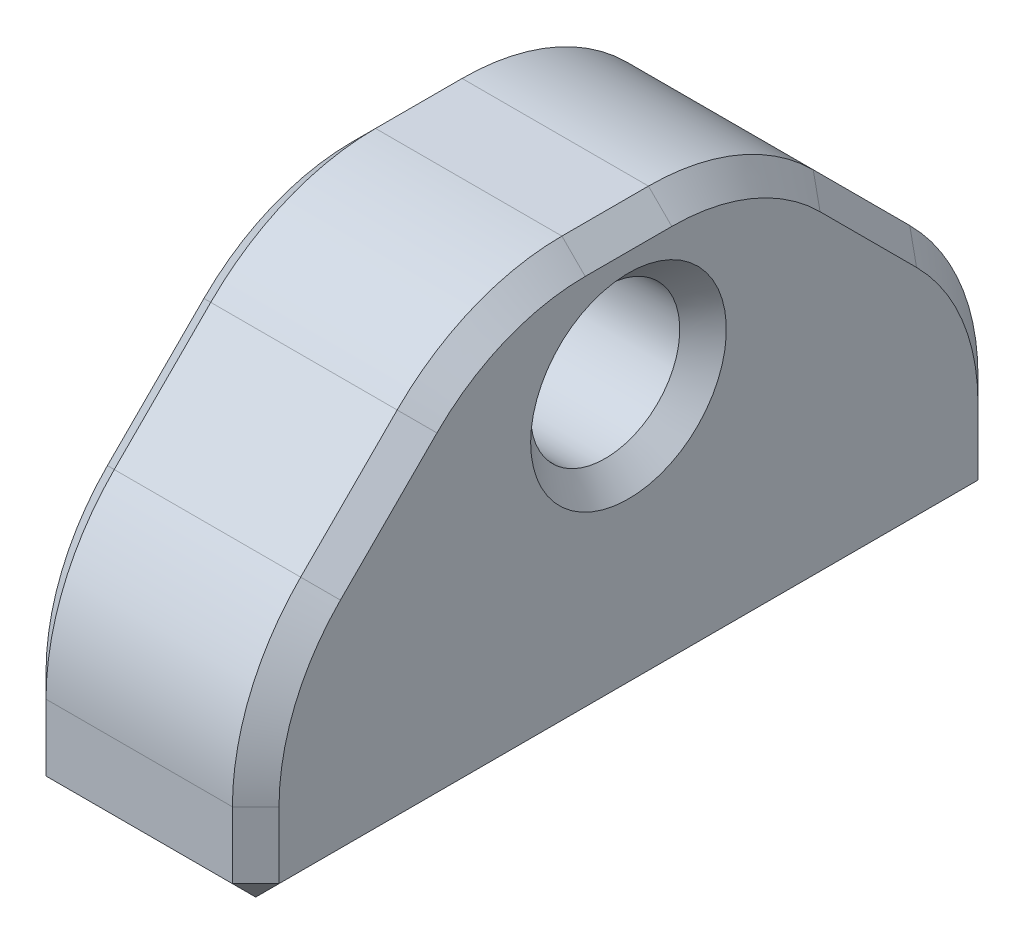
from build123d import *

# Parameters (mm, degrees)
SKETCH1_W           = 6.35
SKETCH1_H           = 20.32
SKETCH1_R           = 2.032
BOSS_EXTRUDE1_DEPTH = 11.43
SKETCH1_3_R         = 2.032
CUT_EXTRUDE1_DEPTH  = 6.35
SKETCH2_R           = 2.032
CUT_EXTRUDE2_DEPTH  = 17.558774109
CHAMFER1_SIZE       = 6.35
FILLET1_R           = 6.35
FILLET2_R           = 6.35
CHAMFER2_SIZE       = 0.635
CHAMFER3_SIZE       = 0.635


with BuildPart() as part:
    # Sketch1 → Boss-Extrude1 (new body)
    # profile 1 of 3: a face of its own
    with BuildSketch(Plane(origin=(0, 0, 0), x_dir=(1, 0, 0), z_dir=(0, 1, 0))):
        Rectangle(SKETCH1_W, SKETCH1_H)
        with Locations((0, -6.35)):
            Circle(SKETCH1_R, mode=Mode.SUBTRACT)
        with Locations((0, 6.35)):
            Circle(SKETCH1_R, mode=Mode.SUBTRACT)
    # profile 2 of 3: a face of its own
    with BuildSketch(Plane(origin=(0, 0, 0), x_dir=(1, 0, 0), z_dir=(0, 1, 0))):
        with Locations((0, -6.35)):
            Circle(SKETCH1_R)
    # profile 3 of 3: a face of its own
    with BuildSketch(Plane(origin=(0, 0, 0), x_dir=(1, 0, 0), z_dir=(0, 1, 0))):
        with Locations((0, 6.35)):
            Circle(SKETCH1_R)
    extrude(amount=BOSS_EXTRUDE1_DEPTH)

    # Sketch1<3> → Cut-Extrude1 (cut)
    with BuildSketch(Plane(origin=(0, 0, 0), x_dir=(1, 0, 0), z_dir=(0, 1, 0))):
        with Locations(Location((0, 6.35, 0), (0, 0, 270))):
            Circle(SKETCH1_3_R)
        with Locations(Location((0, -6.35, 0), (0, 0, 270))):
            Circle(SKETCH1_3_R)
    extrude(amount=CUT_EXTRUDE1_DEPTH, mode=Mode.SUBTRACT)

    # Sketch2 → Cut-Extrude2 (cut, through all)
    with BuildSketch(Plane(origin=(3.175, 0, 0), x_dir=(0, 0, -1), z_dir=(1, 0, 0))):
        with Locations((0, 7.62)):
            Circle(SKETCH2_R)
    extrude(amount=-CUT_EXTRUDE2_DEPTH, mode=Mode.SUBTRACT)

    # Chamfer1
    chamfer1_edges = [part.edges().sort_by_distance(p)[0] for p in [
        (0, 11.43, -10.16),
        (0, 11.43, 10.16),
    ]]
    chamfer(chamfer1_edges, length=CHAMFER1_SIZE)

    # Fillet1
    fillet1_edges = [part.edges().sort_by_distance(p)[0] for p in [
        (0, 11.43, 3.81),
        (0, 11.43, -3.81),
    ]]
    fillet(fillet1_edges, radius=FILLET1_R)

    # Fillet2
    fillet2_edges = [part.edges().sort_by_distance(p)[0] for p in [
        (0, 5.08, -10.16),
        (0, 5.08, 10.16),
    ]]
    fillet(fillet2_edges, radius=FILLET2_R)

    # Chamfer2
    chamfer2_edges = [part.edges().sort_by_distance(p)[0] for p in [
        (3.175, 11.43, 0),
        (-3.175, 11.43, 0),
        (-3.175, 8.255, -6.985),
        (-3.175, 10.946635031, 3.609783674),
        (-3.175, 10.946635031, -3.609783674),
        (3.175, 8.255, 6.985),
        (3.175, 10.946635031, 3.609783674),
        (3.175, 10.946635031, -3.609783674),
        (-3.175, 0, 0),
        (-3.175, 1.224871939, -10.16),
        (3.175, 1.224871939, -10.16),
        (3.175, 8.255, -6.985),
        (3.175, 1.224871939, 10.16),
        (3.175, 4.879783674, 9.676635031),
        (3.175, 4.879783674, -9.676635031),
        (-3.175, 1.224871939, 10.16),
        (0, 0, -10.16),
        (-3.175, 8.255, 6.985),
        (-3.175, 4.879783674, 9.676635031),
        (-3.175, 4.879783674, -9.676635031),
        (3.175, 0, 0),
        (0, 0, 10.16),
    ]]
    chamfer(chamfer2_edges, length=CHAMFER2_SIZE)

    # Chamfer3
    # the kernel refuses this chamfer: 0.635 mm, written as the material it takes off along each edge
    with BuildSketch(Plane(origin=(0, 0, 6.35), x_dir=(0, 0, 1), z_dir=(-1, 0, 0))) as chamfer3_piece_1:
        Polygon((2.032 + CHAMFER3_SIZE, 0), (2.032, CHAMFER3_SIZE), (2.032, 0), align=None)
    revolve(axis=Axis((0, 0, 6.35), (0, 1, 0)), mode=Mode.SUBTRACT)
    with BuildSketch(Plane(origin=(0, 0, -6.35), x_dir=(0, 0, 1), z_dir=(-1, 0, 0))) as chamfer3_piece_2:
        Polygon((2.032 + CHAMFER3_SIZE, 0), (2.032, CHAMFER3_SIZE), (2.032, 0), align=None)
    revolve(axis=Axis((0, 0, -6.35), (0, 1, 0)), mode=Mode.SUBTRACT)
    with BuildSketch(Plane(origin=(-3.175, 7.62, 0), x_dir=(0, 0, -1), z_dir=(0, -1, 0))) as chamfer3_piece_3:
        Polygon((2.032 + CHAMFER3_SIZE, 0), (2.032, CHAMFER3_SIZE), (2.032, 0), align=None)
    revolve(axis=Axis((-3.175, 7.62, 0), (1, 0, 0)), mode=Mode.SUBTRACT)
    with BuildSketch(Plane(origin=(3.175, 7.62, 0), x_dir=(0, 0, -1), z_dir=(0, -1, 0))) as chamfer3_piece_4:
        Polygon((2.032, -CHAMFER3_SIZE), (2.032 + CHAMFER3_SIZE, 0), (2.032, 0), align=None)
    revolve(axis=Axis((3.175, 7.62, 0), (1, 0, 0)), mode=Mode.SUBTRACT)


solid = part.part
